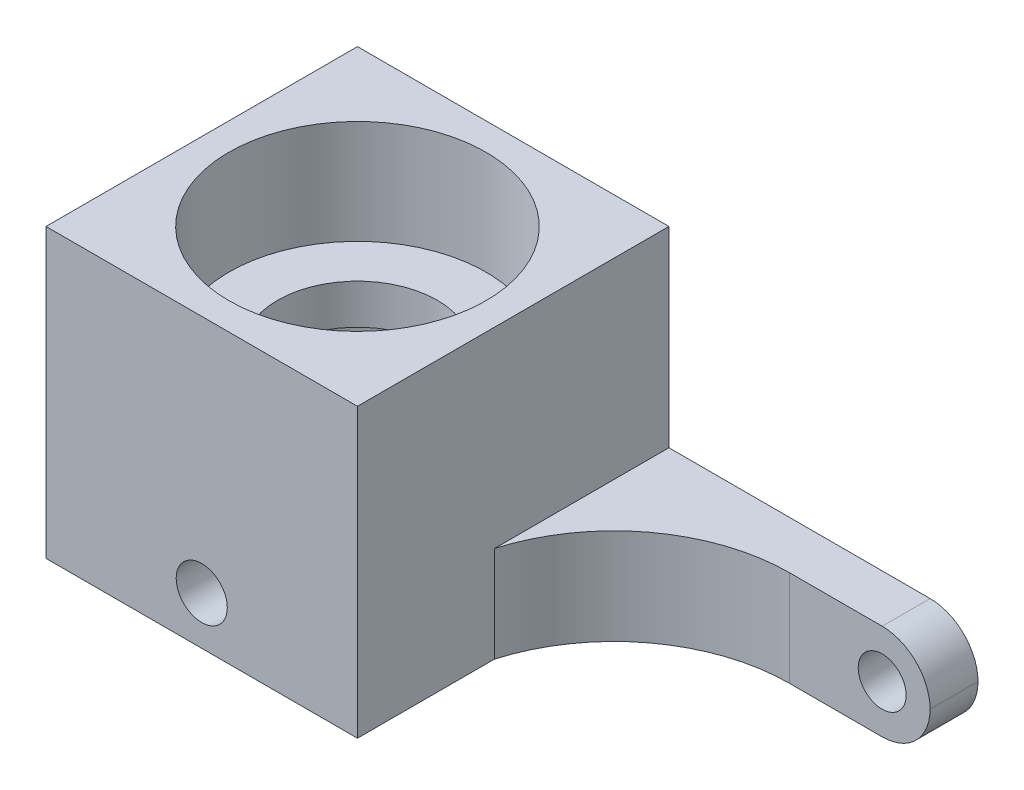
from build123d import *

# Parameters (mm, degrees)
SKETCH1_R               = 9.75
BOSS_EXTRUDE1_DEPTH     = 18
SKETCH4_5_R             = 1.5
SKETCH4_5_R_2           = 1.6
BOSS_EXTRUDE3_DEPTH     = 3
BOSS_EXTRUDE5_REACH     = 41.383
SKETCH1_4_R             = 7.5
CUT_EXTRUDE2_DEPTH      = 9
CUT_EXTRUDE8_START      = 18
SKETCH1_6_R             = 8.05
CUT_EXTRUDE8_DEPTH      = 6.5
CUT_EXTRUDE5_DEPTH      = 40.383499083
CUT_EXTRUDE5_DEPTH_BACK = 40.383499083
SKETCH4_R               = 1.6
FILLET8_R               = 11
FILLET9_R               = 3
CUT_EXTRUDE9_START      = 11.5
SKETCH1_8_R             = 5
CUT_EXTRUDE9_DEPTH      = 4
BOSS_EXTRUDE6_REACH     = 41.383
SKETCH5_R               = 1.6


# Some blends are built 0.0001 mm under size
with BuildPart() as part:
    # Sketch1 → Boss-Extrude1 (new body)
    with BuildSketch(Plane(origin=(0, 0, 0), x_dir=(1, 0, 0), z_dir=(0, 1, 0))):
        with Locations(Location((0, 0, 0), (0, 0, 270))):
            Circle(SKETCH1_R)
    extrude(amount=BOSS_EXTRUDE1_DEPTH)

    # Sketch4<5> → Boss-Extrude3 (add)
    with BuildSketch(Plane(origin=(0, 0, -9.75), x_dir=(-1, 0, 0), z_dir=(0, 0, -1))):
        Polygon((-9.75, 18), (-9.75, 6), (-29.1, 6), (-29.1, 0), (9.75, 0), (9.75, 18), align=None)
        with Locations((-26.1, 3)):
            Circle(SKETCH4_5_R, mode=Mode.SUBTRACT)
        with Locations((0, 3)):
            Circle(SKETCH4_5_R_2, mode=Mode.SUBTRACT)
    extrude(amount=-BOSS_EXTRUDE3_DEPTH)

    # Sketch4<8> → Boss-Extrude5 (add, up to next)
    with BuildSketch(Plane(origin=(0, 0, -9.75), x_dir=(-1, 0, 0), z_dir=(0, 0, -1)), mode=Mode.PRIVATE) as boss_extrude5_sk1:
        with BuildLine():
            Line((0, 18), (-9.75, 18))
            Line((-9.75, 18), (-9.75, 6))
            Line((-9.75, 6), (-9.75, 0))
            Line((-9.75, 0), (0, 0))
            Line((0, 0), (0, 1.4))
            ThreePointArc((0, 1.4), (-1.6, 3), (0, 4.6))
            Line((0, 4.6), (0, 18))
        make_face()
    boss_extrude5_tool1 = extrude(boss_extrude5_sk1.sketch, amount=-BOSS_EXTRUDE5_REACH, mode=Mode.PRIVATE) - part.part
    # Sketch4<8> → Boss-Extrude5 (add, up to next)
    with BuildSketch(Plane(origin=(0, 0, -9.75), x_dir=(-1, 0, 0), z_dir=(0, 0, -1)), mode=Mode.PRIVATE) as boss_extrude5_sk2:
        with BuildLine():
            Line((9.75, 18), (0, 18))
            Line((0, 18), (0, 4.6))
            ThreePointArc((0, 4.6), (1.13137085, 4.13137085), (1.6, 3))
            ThreePointArc((1.6, 3), (1.13137085, 1.86862915), (0, 1.4))
            Line((0, 1.4), (0, 0))
            Line((0, 0), (9.75, 0))
            Line((9.75, 0), (9.75, 18))
        make_face()
    boss_extrude5_tool2 = extrude(boss_extrude5_sk2.sketch, amount=-BOSS_EXTRUDE5_REACH, mode=Mode.PRIVATE) - part.part
    add(boss_extrude5_tool1.solids().sort_by_distance((4.973396, 9.140702, -9.75))[0])
    add(boss_extrude5_tool2.solids().sort_by_distance((-4.973396, 9.140702, -9.75))[0])

    # Sketch1<4> → Cut-Extrude2 (cut)
    with BuildSketch(Plane(origin=(0, 0, 0), x_dir=(1, 0, 0), z_dir=(0, 1, 0))):
        with Locations(Location((0, 0, 0), (0, 0, 270))):
            Circle(SKETCH1_4_R)
    extrude(amount=CUT_EXTRUDE2_DEPTH, mode=Mode.SUBTRACT)

    # Sketch1<6> → Cut-Extrude8 (cut)
    with BuildSketch(Plane(origin=(0, 0, 0), x_dir=(1, 0, 0), z_dir=(0, 1, 0)).offset(CUT_EXTRUDE8_START)):
        with Locations(Location((0, 0, 0), (0, 0, 270))):
            Circle(SKETCH1_6_R)
    extrude(amount=-CUT_EXTRUDE8_DEPTH, mode=Mode.SUBTRACT)

    # Sketch4 → Cut-Extrude5 (cut, two sides: drawn at the far end of the back side and taken through both)
    with BuildSketch(Plane(origin=(0, 0, -9.75), x_dir=(-1, 0, 0), z_dir=(0, 0, -1)).offset(-CUT_EXTRUDE5_DEPTH_BACK)):
        with Locations((0, 3)):
            Circle(SKETCH4_R)
    extrude(amount=CUT_EXTRUDE5_DEPTH + CUT_EXTRUDE5_DEPTH_BACK, mode=Mode.SUBTRACT)

    # Fillet8
    # the kernel refuses this fillet: 11 mm, written as the material it adds along each edge
    with BuildSketch(Plane(origin=(9.75, 0, -6.75), x_dir=(1, 0, 0), z_dir=(0, 1, 0))) as fillet8_piece_1:
        with BuildLine():
            CenterArc((10.560096012, -11), FILLET8_R, 90, 78.18108009)
            Line((-0.206701874, -8.746987952), (-1.283381663, -8.521686747))
            ThreePointArc((-1.283381663, -8.521686747), (-1.1, -6.75), (-1.1, 0))
            Line((-1.1, 0), (0, 1.1))
            Line((0, 1.1), (10.560096012, 1.1))
            Line((10.560096012, 1.1), (10.560096012, 0))
        make_face()
    extrude(amount=6)

    # Fillet9
    fillet9_edges = [part.edges().sort_by_distance(p)[0] for p in [
        (29.1, 0, -8.25),
        (29.1, 6, -8.25),
    ]]
    fillet(fillet9_edges, radius=FILLET9_R - 0.0001)  # a hair under: the kernel refuses the full size

    # Sketch1<8> → Cut-Extrude9 (cut)
    with BuildSketch(Plane(origin=(0, 0, 0), x_dir=(1, 0, 0), z_dir=(0, 1, 0)).offset(CUT_EXTRUDE9_START)):
        with Locations(Location((0, 0, 0), (0, 0, 270))):
            Circle(SKETCH1_8_R)
    extrude(amount=-CUT_EXTRUDE9_DEPTH, mode=Mode.SUBTRACT)

    # Sketch5 → Boss-Extrude6 (add, up to next)
    with BuildSketch(Plane.XY.offset(9.75), mode=Mode.PRIVATE) as boss_extrude6_sk1:
        Polygon((9.75, 0), (-9.75, 0), (-9.75, 18), (9.75, 18), (9.75, 6), align=None)
        with Locations(Location((0, 3, 0), (0, 0, 180))):
            Circle(SKETCH5_R, mode=Mode.SUBTRACT)
    boss_extrude6_tool1 = extrude(boss_extrude6_sk1.sketch, amount=-BOSS_EXTRUDE6_REACH, mode=Mode.PRIVATE) - part.part
    add(boss_extrude6_tool1.solids().sort_by_distance((0, 9.140702, 9.75))[0])
    add(boss_extrude6_tool1.solids().sort_by_distance((0, 9.140702, 9.75))[1])


solid = part.part
